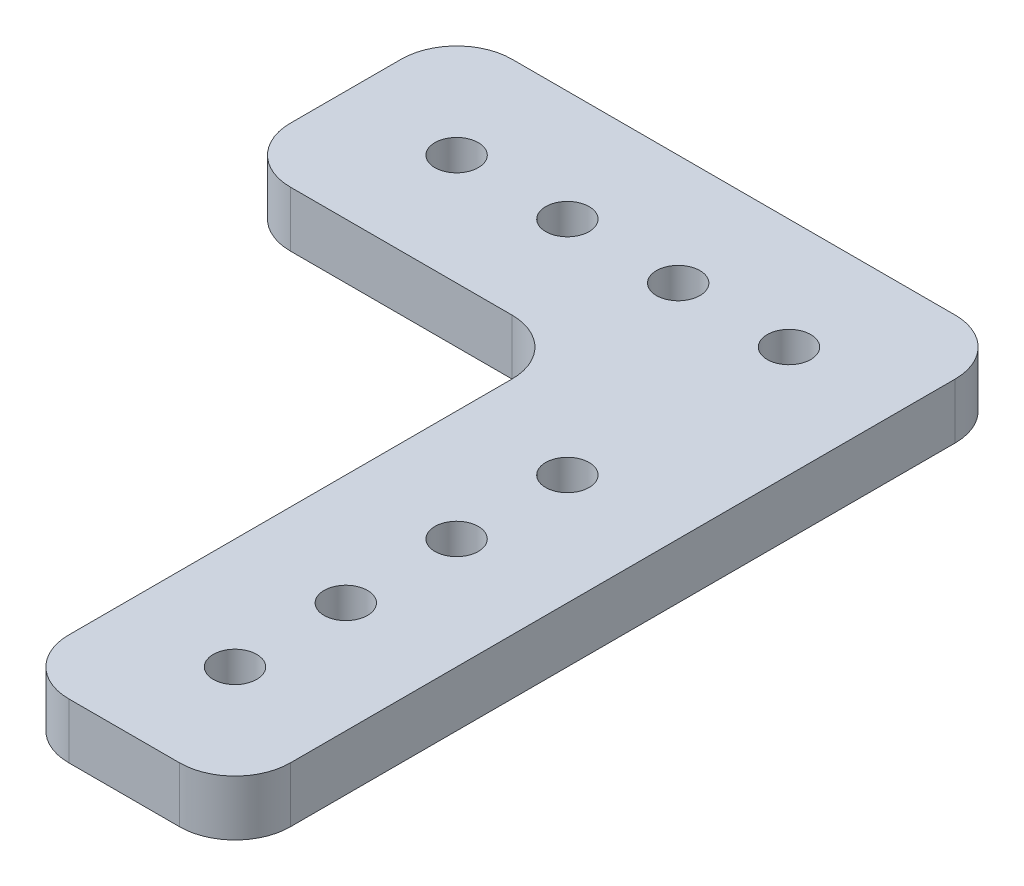
from build123d import *

# Parameters (mm, degrees)
SKETCH1_R           = 2.4892
BOSS_EXTRUDE1_DEPTH = 6.35
FILLET1_R           = 6.35


with BuildPart() as part:
    # Sketch1 → Boss-Extrude1 (new body)
    with BuildSketch(Plane(origin=(0, 0, 0), x_dir=(1, 0, 0), z_dir=(0, 1, 0))):
        Polygon((0, 63.5), (0, 0), (25.4, 0), (25.4, 88.9), (-38.1, 88.9), (-38.1, 63.5), align=None)
        with Locations((12.7, 12.7)):
            Circle(SKETCH1_R, mode=Mode.SUBTRACT)
        with Locations((12.7, 25.4)):
            Circle(SKETCH1_R, mode=Mode.SUBTRACT)
        with Locations((12.7, 38.1)):
            Circle(SKETCH1_R, mode=Mode.SUBTRACT)
        with Locations((12.7, 50.8)):
            Circle(SKETCH1_R, mode=Mode.SUBTRACT)
        with Locations((0, 76.2)):
            Circle(SKETCH1_R, mode=Mode.SUBTRACT)
        with Locations((12.7, 76.2)):
            Circle(SKETCH1_R, mode=Mode.SUBTRACT)
        with Locations((-25.4, 76.2)):
            Circle(SKETCH1_R, mode=Mode.SUBTRACT)
        with Locations((-12.7, 76.2)):
            Circle(SKETCH1_R, mode=Mode.SUBTRACT)
    extrude(amount=BOSS_EXTRUDE1_DEPTH)

    # Fillet1
    fillet1_edges = [part.edges().sort_by_distance(p)[0] for p in [
        (0, 3.175, 0),
        (0, 3.175, -63.5),
        (-38.1, 3.175, -63.5),
        (-38.1, 3.175, -88.9),
        (25.4, 3.175, -88.9),
        (25.4, 3.175, 0),
    ]]
    fillet(fillet1_edges, radius=FILLET1_R)


solid = part.part
